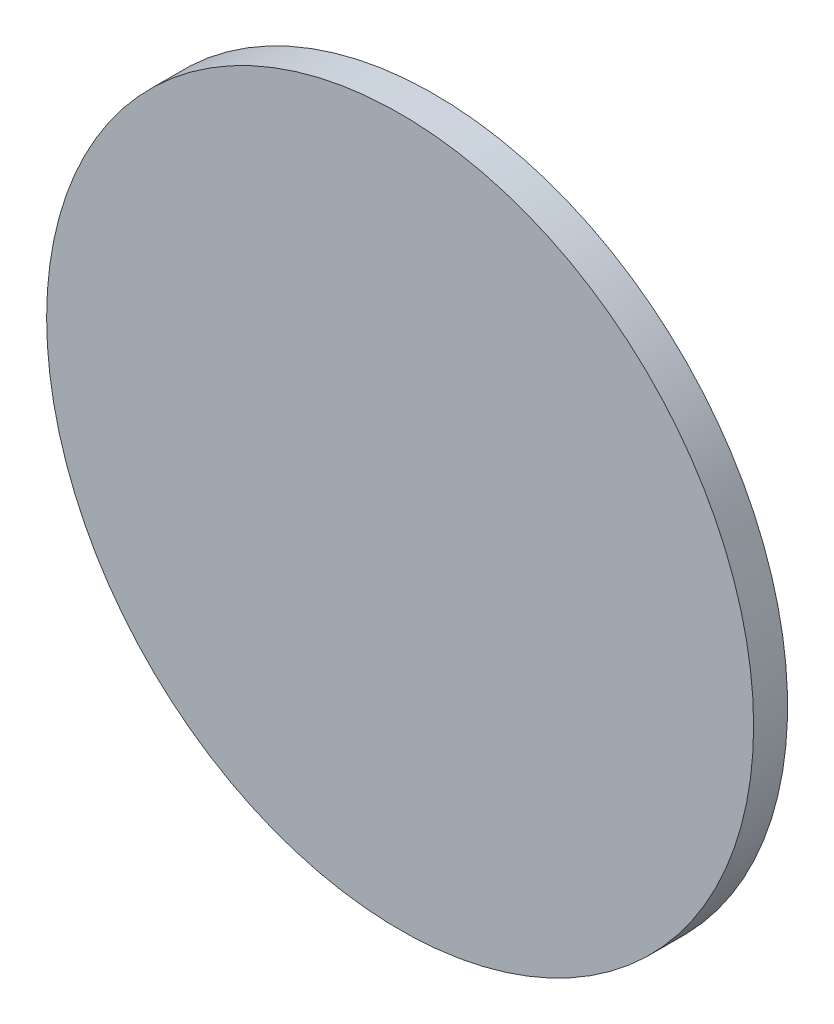
from build123d import *

# Parameters (mm, degrees)
SKETCH1_W                = 52.046958378
SKETCH1_H                = 10
BOSS_EXTRUDE1_DEPTH      = 15
BOSS_EXTRUDE1_DEPTH_BACK = 5
SKETCH2_R                = 6
CHAMFER1_SIZE            = 0.5
THREAD1_PITCH            = 1.5
FILLET1_R                = 0.5
SKETCH3_R                = 52.046958378
CUT_EXTRUDE1_DEPTH       = 5


with BuildPart() as part:
    # Sketch1 → Revolve1 (revolve)
    with BuildSketch(Plane(origin=(0, 0, 0), x_dir=(1, 0, 0), z_dir=(0, 1, 0)), mode=Mode.PRIVATE) as revolve1_sk:
        with Locations((26.023479189, -5)):
            Rectangle(SKETCH1_W, SKETCH1_H)
    revolve(revolve1_sk.sketch.rotate(Axis((0, 0, 0), (0, 0, 1)), 180), axis=Axis((0, 0, 0), (0, 0, 1)))

    # Sketch2 → Boss-Extrude1 (add, two sides: drawn at the far end of the back side and taken through both)
    with BuildSketch(Plane(origin=(0, 0, 0), x_dir=(-1, 0, 0), z_dir=(0, 0, -1)).offset(-BOSS_EXTRUDE1_DEPTH_BACK)):
        Circle(SKETCH2_R)
    extrude(amount=BOSS_EXTRUDE1_DEPTH + BOSS_EXTRUDE1_DEPTH_BACK)

    # Chamfer1
    chamfer1_edges = [part.edges().sort_by_distance(p)[0] for p in [
        (6, 0, -15),
    ]]
    chamfer(chamfer1_edges, length=CHAMFER1_SIZE)

    # Thread1: the profile of Thread Profile1 profile screwed along a right-hand helix of 8.666667 turns, 8 arcs to a turn; built about Z, then put on its axis
    thread1_z = Axis((0, 0, 0), (0, 0, 1))
    thread1_corners = [(6.0003, 0, -0.000173205), (6.0003, 0, 1.312673201), (5.188101188, 0, 0.843749998), (5.188101188, 0, 0.468749998)]
    with BuildLine(mode=Mode.PRIVATE) as thread1_profile:
        Line(thread1_corners[0], thread1_corners[1])
        Line(thread1_corners[1], thread1_corners[2])
        Line(thread1_corners[2], thread1_corners[3])
        Line(thread1_corners[3], thread1_corners[0])
    thread1_cap = Face(thread1_profile.wire())
    thread1_turn_angles = [0, 22.5, 45, 67.5, 90, 112.5, 135, 157.5, 180, 202.5, 225, 247.5, 270, 292.5, 315, 337.5, 360]
    thread1_turn_weights = [1, 0.9238795325112867, 1, 0.9238795325112867, 1, 0.9238795325112867, 1, 0.9238795325112867, 1, 0.9238795325112867, 1, 0.9238795325112867, 1, 0.9238795325112867, 1, 0.9238795325112867, 1]
    thread1_turn_rails = [Edge.make_bspline([Vector(p[0], p[1], 0).rotate(thread1_z, thread1_turn_angles[k]) / thread1_turn_weights[k] + Vector(0, 0, p[2] + THREAD1_PITCH * thread1_turn_angles[k] / 360) for k in range(17)], [0, 0, 0, 1, 1, 2, 2, 3, 3, 4, 4, 5, 5, 6, 6, 7, 7, 8, 8, 8], 2, thread1_turn_weights) for p in thread1_corners]
    thread1_turn_sides = [Face.make_surface_from_curves(thread1_turn_rails[p[0]], thread1_turn_rails[p[1]]) for p in [(0, 1), (1, 2), (2, 3), (3, 0)]]
    thread1_last_angles = [2880, 2902.5, 2925, 2947.5, 2970, 2992.5, 3015, 3037.5, 3060, 3082.5, 3105, 3112.5, 3120]
    thread1_last_weights = [1, 0.9238795325112867, 1, 0.9238795325112867, 1, 0.9238795325112867, 1, 0.9238795325112867, 1, 0.9238795325112867, 1, 0.9914448613738109, 1]
    thread1_last_rails = [Edge.make_bspline([Vector(p[0], p[1], 0).rotate(thread1_z, thread1_last_angles[k]) / thread1_last_weights[k] + Vector(0, 0, p[2] + THREAD1_PITCH * thread1_last_angles[k] / 360) for k in range(13)], [0, 0, 0, 1, 1, 2, 2, 3, 3, 4, 4, 5, 5, 6, 6, 6], 2, thread1_last_weights) for p in thread1_corners]
    thread1_last_sides = [Face.make_surface_from_curves(thread1_last_rails[p[0]], thread1_last_rails[p[1]]) for p in [(0, 1), (1, 2), (2, 3), (3, 0)]]
    thread1 = Plane(origin=(0, 0, -2), x_dir=(-1, 0, 0), z_dir=(0, 0, -1)) * Solid(Shell([*[p.moved(Location((0, 0, THREAD1_PITCH * i))) for i in range(8) for p in thread1_turn_sides], *thread1_last_sides, thread1_cap, thread1_cap.rotate(thread1_z, 3120).moved(Location((0, 0, THREAD1_PITCH * 3120 / 360)))]))
    add(thread1, mode=Mode.SUBTRACT)

    # Fillet1
    fillet1_edges = [part.edges().sort_by_distance(p)[0] for p in [
        (6, 0, 0),
    ]]
    fillet(fillet1_edges, radius=FILLET1_R)

    # Sketch3 → Cut-Extrude1 (cut)
    with BuildSketch(Plane.XY.offset(10)):
        with Locations(Location((0, 0, 0), (0, 0, 180))):
            Circle(SKETCH3_R)
    extrude(amount=-CUT_EXTRUDE1_DEPTH, mode=Mode.SUBTRACT)


solid = part.part
